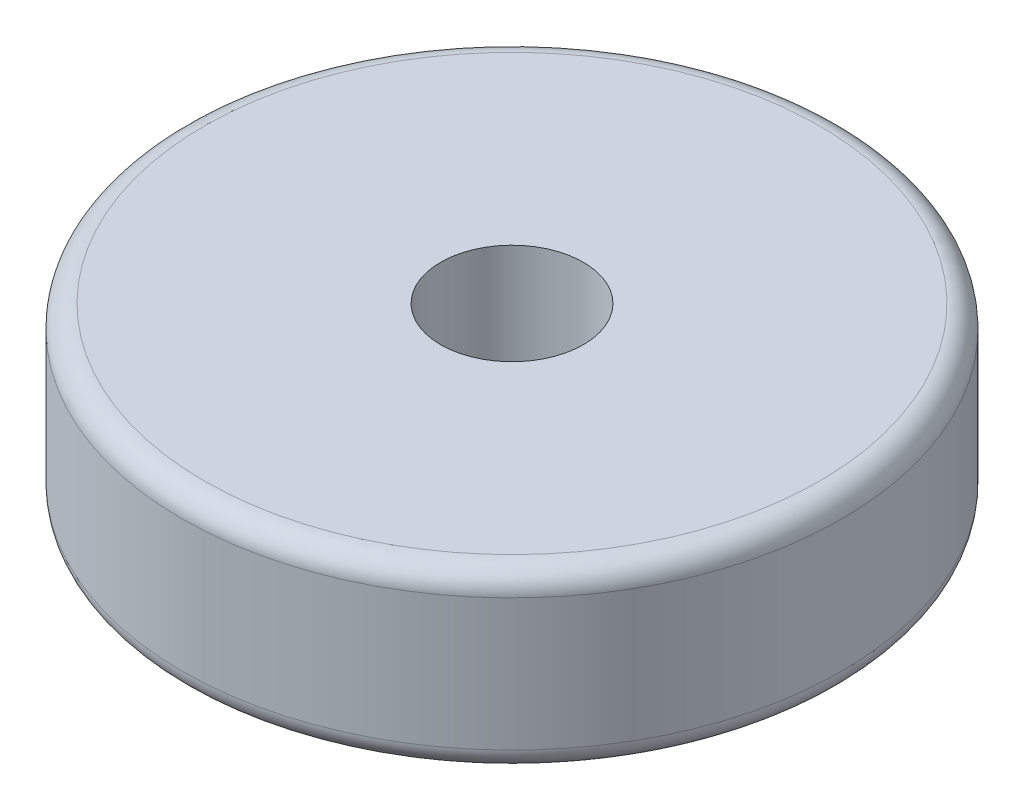
from build123d import *

# Parameters (mm, degrees)
SKETCH1_R           = 7.5
BOSS_EXTRUDE1_DEPTH = 4
SKETCH2_R           = 1.625
CUT_EXTRUDE1_DEPTH  = 4
FILLET1_R           = 0.5


with BuildPart() as part:
    # Sketch1 → Boss-Extrude1 (new body)
    with BuildSketch(Plane(origin=(0, 0, 0), x_dir=(1, 0, 0), z_dir=(0, 1, 0))):
        Circle(SKETCH1_R)
    extrude(amount=BOSS_EXTRUDE1_DEPTH)

    # Sketch2 → Cut-Extrude1 (cut)
    with BuildSketch(Plane(origin=(0, 4, 0), x_dir=(1, 0, 0), z_dir=(0, 1, 0))):
        Circle(SKETCH2_R)
    extrude(amount=-CUT_EXTRUDE1_DEPTH, mode=Mode.SUBTRACT)

    # Fillet1
    fillet1_edges = [part.edges().sort_by_distance(p)[0] for p in [
        (-7.5, 0, 0),
        (-7.5, 4, 0),
    ]]
    fillet(fillet1_edges, radius=FILLET1_R)


solid = part.part
